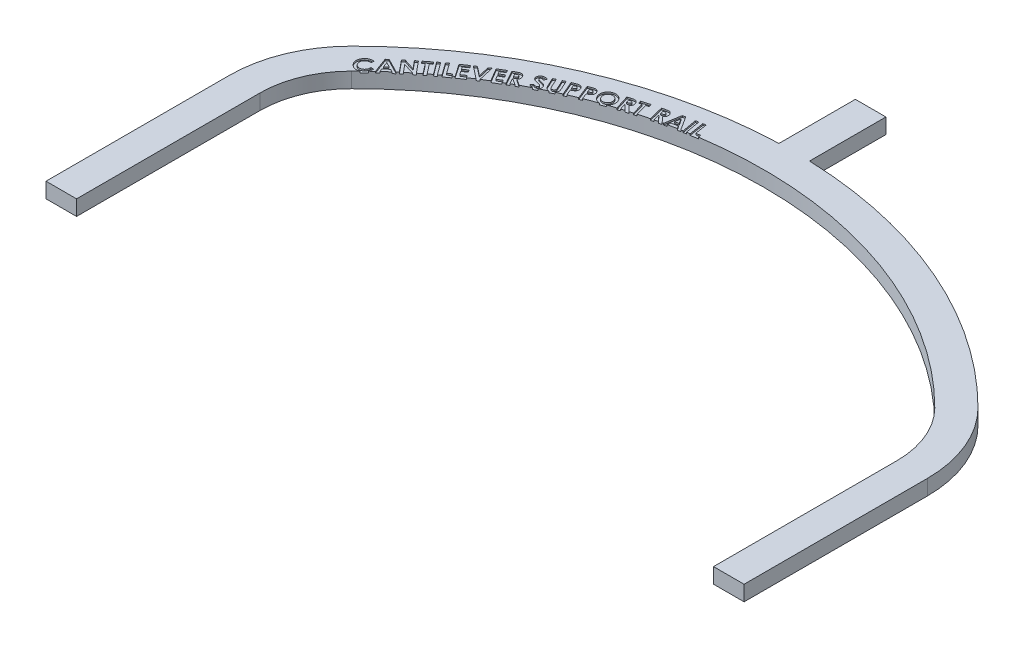
from build123d import *

# Parameters (mm, degrees)
BOSS_EXTRUDE1_DEPTH = 12.7
CUT_EXTRUDE1_DEPTH  = 1.27


with BuildPart() as part:
    # Sketch1 → Boss-Extrude1 (new body)
    with BuildSketch(Plane(origin=(0, 0, 0), x_dir=(1, 0, 0), z_dir=(0, 1, 0))):
        with BuildLine():
            Line((-12.7, 368.080969353), (-12.7, 431.580969353))
            Line((-12.7, 431.580969353), (12.7, 431.580969353))
            Line((12.7, 431.580969353), (12.7, 368.080969353))
            ThreePointArc((12.7, 368.080969353), (146.788859191, 337.783837413), (260.427427511, 260.427427511))
            ThreePointArc((260.427427511, 260.427427511), (282.451539046, 227.466015271), (290.185378542, 188.585378542))
            Line((290.185378542, 188.585378542), (290.185378542, 36.185378542))
            Line((290.185378542, 36.185378542), (264.785378542, 36.185378542))
            Line((264.785378542, 36.185378542), (264.785378542, 188.585378542))
            ThreePointArc((264.785378542, 188.585378542), (258.98499892, 217.745856089), (242.466915269, 242.466915269))
            ThreePointArc((242.466915269, 242.466915269), (0, 342.9), (-242.466915269, 242.466915269))
            ThreePointArc((-242.466915269, 242.466915269), (-258.98499892, 217.745856089), (-264.785378542, 188.585378542))
            Line((-264.785378542, 188.585378542), (-264.785378542, 36.185378542))
            Line((-264.785378542, 36.185378542), (-290.185378542, 36.185378542))
            Line((-290.185378542, 36.185378542), (-290.185378542, 188.585378542))
            ThreePointArc((-290.185378542, 188.585378542), (-282.451539046, 227.466015271), (-260.427427511, 260.427427511))
            ThreePointArc((-260.427427511, 260.427427511), (-146.788859191, 337.783837413), (-12.7, 368.080969353))
        make_face()
    extrude(amount=BOSS_EXTRUDE1_DEPTH)

    # Sketch2 → Cut-Extrude1 (cut)
    # profile 1 of 21: a face of its own
    with BuildSketch(Plane(origin=(0, 12.7, 0), x_dir=(1, 0, 0), z_dir=(0, 1, 0))):
        with BuildLine():
            Line((-240.273926487, 259.051710942), (-240.373145237, 256.721342352))
            add(Edge.make_bspline(
                [(-240.373145237, 256.721342352), (-240.576716843, 256.726749918), (-240.974276484, 256.737310475), (-241.557085733, 256.690475958), (-242.10963239, 256.593427501), (-242.63458079, 256.450482021), (-243.128175298, 256.249216858), (-243.593783069, 256.002014349), (-244.030973083, 255.704187979), (-244.291951553, 255.466949541), (-244.423305493, 255.347544275)],
                knots=[0, 0, 0, 0, 1.109410941, 2.166593966, 3.18036216, 4.16389883, 5.126121317, 6.079420305, 7.033346654, 8, 8, 8, 8], degree=3))
            add(Edge.make_bspline(
                [(-244.423305493, 255.347544275), (-244.528072502, 255.241800963), (-244.734045834, 255.033908207), (-245.001629247, 254.692988257), (-245.229723619, 254.337565094), (-245.418647135, 253.966808494), (-245.57098915, 253.581661237), (-245.677023148, 253.178264019), (-245.745411494, 252.760813784), (-245.77563675, 252.332500019), (-245.767119493, 251.903693619), (-245.712007309, 251.484812269), (-245.62189857, 251.078980889), (-245.484529469, 250.688795813), (-245.311419097, 250.309756904), (-245.096259922, 249.945273793), (-244.841692858, 249.593983185), (-244.643510262, 249.378949796), (-244.542876807, 249.26975982)],
                knots=[0, 0, 0, 0, 1.05288539, 2.069986666, 3.060674536, 4.03779584, 5.010871382, 5.986369008, 6.983996698, 8.000938564, 9.021611171, 10.014024932, 10.98669312, 11.958583158, 12.936202096, 13.931660634, 14.949735543, 16, 16, 16, 16], degree=3))
            add(Edge.make_bspline(
                [(-244.542876807, 249.26975982), (-244.469992066, 249.195895281), (-244.32575831, 249.049722575), (-244.096753417, 248.849630549), (-243.861693261, 248.66735926), (-243.619076708, 248.505421597), (-243.373378149, 248.356767394), (-243.120280478, 248.228379112), (-242.858984774, 248.12245874), (-242.506406183, 248.000207541), (-242.05483905, 247.896093391), (-241.504146585, 247.850308565), (-240.948984553, 247.880408267), (-240.489724297, 247.974389112), (-240.12527083, 248.080189741), (-239.858646368, 248.183593393), (-239.597394816, 248.300639345), (-239.34311415, 248.435459887), (-239.095701951, 248.588337235), (-238.857191155, 248.759684747), (-238.622858909, 248.945615153), (-238.476039778, 249.082982597), (-238.401490589, 249.152732577)],
                knots=[0, 0, 0, 0, 0.903983805, 1.7889201, 2.647675703, 3.494134373, 4.329292565, 5.14887473, 5.964014139, 6.784262305, 8.399364139, 9.986327642, 11.584947547, 13.226924465, 14.059299172, 14.889604802, 15.716450468, 16.552784756, 17.395623025, 18.248636513, 19.110724021, 20, 20, 20, 20], degree=3))
            add(Edge.make_bspline(
                [(-238.401490589, 249.152732577), (-238.280966974, 249.275006429), (-238.044501818, 249.514905517), (-237.740145463, 249.910276206), (-237.486535234, 250.325038079), (-237.314385973, 250.688928367), (-237.201384791, 250.9963086), (-237.12851714, 251.245539515), (-237.065142273, 251.513063767), (-237.011790888, 251.798349374), (-236.969856756, 252.101597557), (-236.932845079, 252.422029565), (-236.910845192, 252.761656736), (-236.904005733, 252.994252922), (-236.900488987, 253.113850365)],
                knots=[0, 0, 0, 0, 1.414772299, 2.775757688, 4.103421722, 5.417293633, 6.087640836, 6.802334444, 7.55712879, 8.353997277, 9.194617046, 10.081161745, 11.01336237, 12, 12, 12, 12], degree=3))
            Line((-236.900488987, 253.113850365), (-234.539591551, 253.019719756))
            add(Edge.make_bspline(
                [(-234.539591551, 253.019719756), (-234.546027697, 252.860223536), (-234.55860632, 252.548508609), (-234.597200809, 252.091938107), (-234.650422087, 251.658376646), (-234.716375542, 251.245721292), (-234.796551834, 250.85572744), (-234.893582706, 250.487185382), (-235.005353778, 250.141698169), (-235.130849493, 249.814230796), (-235.274881576, 249.500887552), (-235.438532332, 249.19591563), (-235.61901758, 248.894523127), (-235.821350239, 248.598838481), (-236.042465372, 248.307104163), (-236.281900061, 248.018599567), (-236.542188787, 247.736298061), (-236.72595829, 247.553535755), (-236.81907873, 247.460925686)],
                knots=[0, 0, 0, 0, 1.23744975, 2.418436995, 3.551148269, 4.623380775, 5.657504473, 6.636663909, 7.576447986, 8.471421849, 9.353993627, 10.248146037, 11.153563916, 12.076289761, 13.024362507, 13.990746612, 14.981862843, 16, 16, 16, 16], degree=3))
            add(Edge.make_bspline(
                [(-236.81907873, 247.460925686), (-236.99605553, 247.298181726), (-237.343544968, 246.978638107), (-237.903355723, 246.56429715), (-238.477739198, 246.211727127), (-239.070967127, 245.928756125), (-239.678857229, 245.707684968), (-240.304008258, 245.55380959), (-240.946266651, 245.468219427), (-241.599014669, 245.445246986), (-242.250458424, 245.487515359), (-242.887266336, 245.597598487), (-243.504473901, 245.771768745), (-244.102148727, 246.009481115), (-244.681130645, 246.311974059), (-245.23858094, 246.681117311), (-245.780004264, 247.11145073), (-246.111420852, 247.442272929), (-246.280476968, 247.611025846)],
                knots=[0, 0, 0, 0, 1.086136487, 2.132601335, 3.14236571, 4.128208339, 5.0982374, 6.061395575, 7.032310345, 8.021872026, 9.00915187, 9.977740874, 10.937605904, 11.902813736, 12.880086424, 13.884766916, 14.921016324, 16, 16, 16, 16], degree=3))
            add(Edge.make_bspline(
                [(-246.280476968, 247.611025846), (-246.385987027, 247.725288446), (-246.594570718, 247.951175107), (-246.88296962, 248.304732033), (-247.140626982, 248.66987764), (-247.369420277, 249.044135404), (-247.571939539, 249.425691813), (-247.741908956, 249.817792825), (-247.888997609, 250.216975325), (-248.001660563, 250.626764322), (-248.089801351, 251.041984175), (-248.144187697, 251.461409023), (-248.174048874, 251.883752386), (-248.168885765, 252.308638961), (-248.143790536, 252.737392303), (-248.07987537, 253.168669057), (-247.991582126, 253.602905495), (-247.874700291, 254.037201896), (-247.730315444, 254.46546796), (-247.560102066, 254.881667027), (-247.366323923, 255.284529582), (-247.144053164, 255.669945221), (-246.900249299, 256.043371426), (-246.628116409, 256.398847736), (-246.337967515, 256.745573823), (-246.122013168, 256.957935847), (-246.013349564, 257.064791871)],
                knots=[0, 0, 0, 0, 1.060695042, 2.096896624, 3.109582217, 4.106601159, 5.087242797, 6.053395843, 7.019548889, 7.986532736, 8.949685488, 9.912560284, 10.869107246, 11.835121756, 12.808984211, 13.796358489, 14.805999798, 15.830298554, 16.861969564, 17.886725538, 18.895687249, 19.908752735, 20.919487071, 21.935240766, 22.961057353, 24, 24, 24, 24], degree=3))
            add(Edge.make_bspline(
                [(-246.013349564, 257.064791871), (-245.918603101, 257.153376509), (-245.729593693, 257.330093713), (-245.427333451, 257.572515398), (-245.118309809, 257.803713924), (-244.792826322, 258.011598313), (-244.457930249, 258.20515363), (-244.110752327, 258.381336192), (-243.751491355, 258.539322994), (-243.380779141, 258.678081092), (-243.004326435, 258.800441138), (-242.622771309, 258.899940969), (-242.238877505, 258.978494278), (-241.851829404, 259.037986808), (-241.46094611, 259.072965658), (-241.067844788, 259.087813895), (-240.671081385, 259.084503401), (-240.406979877, 259.062696952), (-240.273926487, 259.051710942)],
                knots=[0, 0, 0, 0, 0.993554142, 1.982037902, 2.96718406, 3.949518728, 4.939283184, 5.930262769, 6.93116342, 7.944974585, 8.962195344, 9.963032712, 10.96471353, 11.963671667, 12.962037854, 13.970001103, 14.977293857, 16, 16, 16, 16], degree=3))
        make_face()
    # profile 2 of 21: a face of its own
    with BuildSketch(Plane(origin=(0, 12.7, 0), x_dir=(1, 0, 0), z_dir=(0, 1, 0))):
        Polygon((-237.04748947, 264.935164083), (-235.218302771, 266.55828107), (-223.164496681, 260.322764243), (-225.039476649, 258.658942128), (-227.512313188, 259.953874019), (-231.376756296, 256.521922897), (-230.415097643, 253.886265846), (-232.290077611, 252.22244373), align=None)
        Polygon((-233.890297963, 263.248445333), (-232.264636905, 258.877732192), (-229.748551168, 261.111426102), align=None, mode=Mode.SUBTRACT)
    # profile 3 of 21: a face of its own
    with BuildSketch(Plane(origin=(0, 12.7, 0), x_dir=(1, 0, 0), z_dir=(0, 1, 0))):
        Polygon((-229.753700372, 271.218781758), (-227.985571366, 272.676534162), (-218.559790116, 269.722868297), (-223.820927936, 276.108485284), (-221.973932744, 277.629839451), (-213.975375052, 267.924210444), (-215.748592199, 266.46391397), (-225.154020885, 269.404859483), (-219.905603417, 263.037050989), (-221.75514268, 261.513152752), align=None)
    # profile 4 of 21: a face of its own
    with BuildSketch(Plane(origin=(0, 12.7, 0), x_dir=(1, 0, 0), z_dir=(0, 1, 0))):
        Polygon((-220.3398183, 278.930040516), (-214.844625992, 283.178638273), (-213.402138011, 281.313834587), (-215.213516217, 279.912051734), (-208.972911249, 271.837171927), (-210.893684486, 270.353978818), (-217.134289454, 278.428858625), (-218.897330319, 277.06523683), align=None)
    # profile 5 of 21: a face of its own
    with BuildSketch(Plane(origin=(0, 12.7, 0), x_dir=(1, 0, 0), z_dir=(0, 1, 0))):
        Polygon((-213.577988538, 284.292750139), (-211.65467123, 285.725061838), (-204.073341102, 275.551323857), (-205.996658409, 274.119012159), align=None)
    # profile 6 of 21: a face of its own
    with BuildSketch(Plane(origin=(0, 12.7, 0), x_dir=(1, 0, 0), z_dir=(0, 1, 0))):
        Polygon((-209.321783282, 287.412693457), (-207.362848987, 288.819564451), (-201.310505237, 280.396146983), (-198.456058121, 282.446667816), (-197.115332961, 280.579320059), (-201.928714371, 277.121928233), align=None)
    # profile 7 of 21: a face of its own
    with BuildSketch(Plane(origin=(0, 12.7, 0), x_dir=(1, 0, 0), z_dir=(0, 1, 0))):
        Polygon((-202.660073181, 292.058496189), (-196.979163726, 295.93311558), (-195.656247059, 293.994533849), (-199.370590008, 291.460639619), (-198.085834399, 289.578027439), (-194.37149145, 292.11192167), (-193.074015489, 290.208956926), (-196.788358437, 287.675062696), (-194.921010681, 284.937642824), (-191.206667732, 287.471537054), (-189.878662925, 285.525323112), (-195.55957238, 281.650703721), align=None)
    # profile 8 of 21: a face of its own
    with BuildSketch(Plane(origin=(0, 12.7, 0), x_dir=(1, 0, 0), z_dir=(0, 1, 0))):
        Polygon((-195.591360854, 296.865199597), (-193.507767104, 298.193204405), (-186.015479444, 292.336754085), (-188.116881687, 301.627699597), (-186.033287937, 302.953160335), (-183.089798354, 289.869005687), (-185.043644508, 288.624955206), align=None)
    # profile 9 of 21: a face of its own
    with BuildSketch(Plane(origin=(0, 12.7, 0), x_dir=(1, 0, 0), z_dir=(0, 1, 0))):
        Polygon((-183.985775363, 304.225697806), (-178.047914786, 307.749235467), (-176.847113504, 305.724155338), (-180.729365107, 303.419227454), (-179.561636741, 301.452660947), (-175.679385139, 303.757588832), (-174.49639235, 301.768125691), (-178.378643953, 299.463197806), (-176.67920485, 296.60111848), (-172.796953248, 298.906046364), (-171.591063825, 296.873334024), (-177.528924402, 293.349796364), align=None)
    # profile 10 of 21: a face of its own
    with BuildSketch(Plane(origin=(0, 12.7, 0), x_dir=(1, 0, 0), z_dir=(0, 1, 0))):
        with BuildLine():
            Line((-175.631666635, 309.022997958), (-173.410693077, 310.254328087))
            add(Edge.make_bspline(
                [(-173.410693077, 310.254328087), (-173.263480566, 310.334671303), (-172.980111142, 310.489323995), (-172.565676345, 310.702409723), (-172.176101972, 310.880822613), (-171.817606084, 311.03944093), (-171.48349854, 311.164257712), (-171.176958167, 311.26117567), (-170.897764935, 311.332269752), (-170.563695603, 311.386775345), (-170.16250014, 311.399284731), (-169.691987248, 311.337221691), (-169.229462888, 311.199528624), (-168.858342417, 311.023381), (-168.570579011, 310.850432042), (-168.362684666, 310.700907549), (-168.164007441, 310.535748229), (-167.976114345, 310.352783588), (-167.799509483, 310.152065754), (-167.632274969, 309.936193282), (-167.472947614, 309.704128205), (-167.378421655, 309.539292569), (-167.330364551, 309.455489946)],
                knots=[0, 0, 0, 0, 1.424970873, 2.742927032, 3.958251133, 5.065194439, 6.072955567, 6.986777354, 7.795889123, 8.518467898, 9.859347431, 11.18920513, 12.534298296, 13.94288944, 14.667011306, 15.384832427, 16.116408083, 16.860333809, 17.610687034, 18.386083837, 19.179483203, 20, 20, 20, 20], degree=3))
            add(Edge.make_bspline(
                [(-167.330364551, 309.455489946), (-167.282252963, 309.366322276), (-167.188117842, 309.191856834), (-167.074062581, 308.9220083), (-166.98053146, 308.655878669), (-166.903964766, 308.392483605), (-166.856347581, 308.12983891), (-166.831127728, 307.868590731), (-166.825150627, 307.609926491), (-166.843186833, 307.35273618), (-166.884597352, 307.099415832), (-166.94486107, 306.846671271), (-167.034027364, 306.597944239), (-167.138391131, 306.347525417), (-167.274253118, 306.10338081), (-167.426018935, 305.85834353), (-167.601978886, 305.615925311), (-167.733803091, 305.461282372), (-167.801017596, 305.382433055)],
                knots=[0, 0, 0, 0, 1.100673466, 2.153577434, 3.179676407, 4.165924668, 5.131279157, 6.075907264, 7.016208807, 7.940151276, 8.873561413, 9.803506696, 10.759576589, 11.74228696, 12.748573433, 13.791994873, 14.874182699, 16, 16, 16, 16], degree=3))
            Line((-167.801017596, 305.382433055), (-162.491542436, 301.93776158))
            Line((-162.491542436, 301.93776158), (-164.776117757, 300.670814465))
            Line((-164.776117757, 300.670814465), (-169.831185866, 303.955209497))
            Line((-169.831185866, 303.955209497), (-170.024535225, 303.845814465))
            Line((-170.024535225, 303.845814465), (-167.444847725, 299.190165426))
            Line((-167.444847725, 299.190165426), (-169.538617757, 298.030069273))
            Line((-169.538617757, 298.030069273), (-175.631666635, 309.022997958))
        make_face()
        with BuildLine():
            Line((-171.156646603, 305.886159016), (-170.50027641, 306.2499611))
            add(Edge.make_bspline(
                [(-170.50027641, 306.2499611), (-170.420111174, 306.295002794), (-170.266498147, 306.381311913), (-170.052548176, 306.517456158), (-169.860048589, 306.647699702), (-169.696628726, 306.781492615), (-169.550756968, 306.905401792), (-169.43125834, 307.029595737), (-169.335162927, 307.151710242), (-169.243811082, 307.310967185), (-169.171936535, 307.520461462), (-169.164096105, 307.790763103), (-169.228872615, 308.075714182), (-169.319765711, 308.257244841), (-169.368165032, 308.353907414)],
                knots=[0, 0, 0, 0, 1.203009883, 2.305213542, 3.317980992, 4.241718513, 5.067472284, 5.820938469, 6.493487216, 7.094992157, 8.217949559, 9.350733708, 10.589302223, 12, 12, 12, 12], degree=3))
            add(Edge.make_bspline(
                [(-169.368165032, 308.353907414), (-169.402027667, 308.411096188), (-169.468099676, 308.522681635), (-169.595091214, 308.66670891), (-169.738628973, 308.785295868), (-169.898583624, 308.876530075), (-170.066564869, 308.946213278), (-170.244920263, 308.984195279), (-170.427390452, 308.997224593), (-170.585482406, 308.984123095), (-170.720062041, 308.956791619), (-170.837049399, 308.924085734), (-170.966358479, 308.873316656), (-171.112055962, 308.815566981), (-171.271609079, 308.744275148), (-171.445060932, 308.659374368), (-171.632908033, 308.563402515), (-171.761483905, 308.492503471), (-171.828281218, 308.455670234)],
                knots=[0, 0, 0, 0, 1.131481788, 2.207721762, 3.255897772, 4.292837267, 5.337614967, 6.344773761, 7.388650056, 8.448042132, 9.038037386, 9.729414435, 10.516576913, 11.405579109, 12.40271825, 13.495929189, 14.699093398, 16, 16, 16, 16], degree=3))
            Line((-171.828281218, 308.455670234), (-172.403241154, 308.13511735))
            Line((-172.403241154, 308.13511735), (-171.156646603, 305.886159016))
        make_face(mode=Mode.SUBTRACT)
    # profile 11 of 21: a face of its own
    with BuildSketch(Plane(origin=(0, 12.7, 0), x_dir=(1, 0, 0), z_dir=(0, 1, 0))):
        with BuildLine():
            Line((-155.315957349, 317.940405077), (-156.203837958, 315.729607801))
            add(Edge.make_bspline(
                [(-156.203837958, 315.729607801), (-156.319176088, 315.788203354), (-156.540405224, 315.90059501), (-156.872889752, 316.034400489), (-157.188257154, 316.128502114), (-157.486044849, 316.190377136), (-157.766632611, 316.211019952), (-158.030331552, 316.196886583), (-158.27836809, 316.145698339), (-158.429160468, 316.078352775), (-158.503677701, 316.045072545)],
                knots=[0, 0, 0, 0, 1.288432312, 2.471331603, 3.564577863, 4.563672574, 5.495453102, 6.35868141, 7.188907812, 8, 8, 8, 8], degree=3))
            add(Edge.make_bspline(
                [(-158.503677701, 316.045072545), (-158.57057279, 316.009315365), (-158.699220048, 315.940550029), (-158.861073853, 315.801295786), (-158.99523472, 315.648477681), (-159.08755168, 315.475067896), (-159.145500397, 315.299874006), (-159.171386729, 315.130031121), (-159.158120634, 314.967130337), (-159.11693731, 314.869801551), (-159.096446131, 314.821374628)],
                knots=[0, 0, 0, 0, 1.207344978, 2.321868833, 3.387898896, 4.435897551, 5.433364484, 6.321697082, 7.164943392, 8, 8, 8, 8], degree=3))
            add(Edge.make_bspline(
                [(-159.096446131, 314.821374628), (-159.071225355, 314.775055794), (-159.020629646, 314.682135011), (-158.909352933, 314.56692111), (-158.783502195, 314.46042556), (-158.684665439, 314.408282871), (-158.633425297, 314.381250429)],
                knots=[0, 0, 0, 0, 0.969066915, 1.944057046, 2.934133273, 4, 4, 4, 4], degree=3))
            add(Edge.make_bspline(
                [(-158.633425297, 314.381250429), (-158.590422241, 314.36196993), (-158.489870172, 314.316887223), (-158.312191668, 314.257686821), (-158.092484214, 314.180603972), (-157.825641453, 314.105050882), (-157.514031017, 314.0169014), (-157.156864137, 313.925581243), (-156.756101259, 313.818267768), (-156.472839172, 313.750469652), (-156.323409272, 313.714703955)],
                knots=[0, 0, 0, 0, 0.469718034, 1.098320083, 1.865848005, 2.79171113, 3.862766277, 5.09555632, 6.467812136, 8, 8, 8, 8], degree=3))
            add(Edge.make_bspline(
                [(-156.323409272, 313.714703955), (-156.184318443, 313.680844563), (-155.920526111, 313.616628624), (-155.545850841, 313.524420257), (-155.212979914, 313.443978523), (-154.922793842, 313.37072155), (-154.675717041, 313.303353774), (-154.469825897, 313.248918688), (-154.307175044, 313.200658757), (-154.213484037, 313.17040778), (-154.173669688, 313.157552513)],
                knots=[0, 0, 0, 0, 1.546761632, 2.933506564, 4.169135563, 5.246970881, 6.167143679, 6.936224424, 7.547944532, 8, 8, 8, 8], degree=3))
            add(Edge.make_bspline(
                [(-154.173669688, 313.157552513), (-154.016782985, 313.101229968), (-153.715924022, 312.993221182), (-153.296947761, 312.803219738), (-152.929710709, 312.593847281), (-152.608639587, 312.365857732), (-152.329052172, 312.11026736), (-152.077468713, 311.830059078), (-151.857620315, 311.51435119), (-151.735087062, 311.286411529), (-151.672848374, 311.170633442)],
                knots=[0, 0, 0, 0, 1.216333729, 2.332542496, 3.352852814, 4.29759538, 5.200260809, 6.112131746, 7.041089328, 8, 8, 8, 8], degree=3))
            add(Edge.make_bspline(
                [(-151.672848374, 311.170633442), (-151.619071436, 311.055332315), (-151.513356717, 310.82867333), (-151.392048285, 310.478205818), (-151.314504171, 310.126209693), (-151.269449129, 309.775334882), (-151.264335304, 309.424564313), (-151.29885114, 309.074423078), (-151.36641626, 308.723241479), (-151.477699992, 308.37755593), (-151.617203149, 308.038873837), (-151.798251489, 307.720193314), (-152.006765611, 307.418777638), (-152.24827892, 307.136064828), (-152.523721939, 306.874708805), (-152.831704952, 306.632243445), (-153.170235509, 306.406460403), (-153.415121943, 306.27790094), (-153.540196131, 306.212240013)],
                knots=[0, 0, 0, 0, 1.027009569, 2.018895665, 2.98750587, 3.932912021, 4.871222577, 5.81364762, 6.76990499, 7.75324346, 8.741505849, 9.722624078, 10.706677686, 11.697570359, 12.719613248, 13.767753892, 14.859894506, 16, 16, 16, 16], degree=3))
            add(Edge.make_bspline(
                [(-153.540196131, 306.212240013), (-153.640516515, 306.16425881), (-153.838468176, 306.069582551), (-154.14108224, 305.952867897), (-154.443002416, 305.860487344), (-154.745041828, 305.792080746), (-155.046450164, 305.742613333), (-155.347789384, 305.7192164), (-155.64793445, 305.723599869), (-155.948394511, 305.744709006), (-156.250365624, 305.794175492), (-156.553940392, 305.868343159), (-156.859933283, 305.968213444), (-157.168286912, 306.093589534), (-157.479258591, 306.24413181), (-157.791473451, 306.421086015), (-158.109311277, 306.61861938), (-158.314665482, 306.768854334), (-158.419723374, 306.84571357)],
                knots=[0, 0, 0, 0, 1.021933519, 2.016473901, 2.978180435, 3.921803429, 4.861198888, 5.783721026, 6.695809493, 7.618331631, 8.550030058, 9.504824365, 10.488428649, 11.506071816, 12.562477444, 13.661869595, 14.80382751, 16, 16, 16, 16], degree=3))
            Line((-158.419723374, 306.84571357), (-157.155320329, 308.847897064))
            add(Edge.make_bspline(
                [(-157.155320329, 308.847897064), (-157.02880397, 308.762273159), (-156.786901833, 308.598558319), (-156.414939997, 308.402897498), (-156.06221176, 308.25138864), (-155.721672047, 308.155578072), (-155.397364401, 308.107360031), (-155.08762386, 308.110575552), (-154.793181022, 308.16920252), (-154.61267824, 308.246776271), (-154.522207349, 308.285657481)],
                knots=[0, 0, 0, 0, 1.295791423, 2.477582482, 3.561755213, 4.548550678, 5.47186939, 6.335783654, 7.165868054, 8, 8, 8, 8], degree=3))
            add(Edge.make_bspline(
                [(-154.522207349, 308.285657481), (-154.434809093, 308.334672036), (-154.264898224, 308.42996119), (-154.044500781, 308.615086749), (-153.871617771, 308.833581934), (-153.742759748, 309.073300699), (-153.661385821, 309.321662394), (-153.629761149, 309.566691929), (-153.65727139, 309.803077924), (-153.716520014, 309.946276513), (-153.746265842, 310.0181695)],
                knots=[0, 0, 0, 0, 1.143564403, 2.223202512, 3.264576636, 4.309597527, 5.317976465, 6.235233605, 7.113997363, 8, 8, 8, 8], degree=3))
            add(Edge.make_bspline(
                [(-153.746265842, 310.0181695), (-153.78219391, 310.080800452), (-153.855267876, 310.208185315), (-154.010468605, 310.374280224), (-154.198562508, 310.522737186), (-154.38359159, 310.630062641), (-154.558436898, 310.710488912), (-154.720498915, 310.772253851), (-154.910274322, 310.839179219), (-155.127503927, 310.907045099), (-155.373034272, 310.975223959), (-155.64604893, 311.046802974), (-155.947342255, 311.119721467), (-156.157997173, 311.168294631), (-156.26743972, 311.193530077)],
                knots=[0, 0, 0, 0, 0.904392643, 1.839440868, 2.832566859, 3.906754087, 4.516791442, 5.248665761, 6.084129627, 7.044262176, 8.106500343, 9.284610759, 10.589260969, 12, 12, 12, 12], degree=3))
            add(Edge.make_bspline(
                [(-156.26743972, 311.193530077), (-156.476215077, 311.242041566), (-156.877519652, 311.335289556), (-157.451790863, 311.480063442), (-157.97474713, 311.62179264), (-158.445869268, 311.763549678), (-158.864915594, 311.905565276), (-159.233348282, 312.044264572), (-159.549095896, 312.183941994), (-159.820529142, 312.32223172), (-160.054319732, 312.469981245), (-160.268321904, 312.619112779), (-160.465843293, 312.776853745), (-160.64271533, 312.945244034), (-160.806377293, 313.119410669), (-160.949242629, 313.30452375), (-161.079296545, 313.496626142), (-161.15150852, 313.631763225), (-161.187672092, 313.699439532)],
                knots=[0, 0, 0, 0, 1.803352331, 3.466374349, 4.982656095, 6.361792992, 7.605036407, 8.704878885, 9.672752931, 10.508866034, 11.265183268, 11.997597242, 12.702959278, 13.389410693, 14.050820359, 14.711652492, 15.354798853, 16, 16, 16, 16], degree=3))
            add(Edge.make_bspline(
                [(-161.187672092, 313.699439532), (-161.232811318, 313.797020898), (-161.322221191, 313.990305947), (-161.422185469, 314.291812745), (-161.485432361, 314.598407538), (-161.516388085, 314.907960277), (-161.513643945, 315.220114917), (-161.477331758, 315.535488343), (-161.407571891, 315.854786698), (-161.307020051, 316.174380908), (-161.175645917, 316.48658383), (-161.014316259, 316.780914647), (-160.831608112, 317.05981052), (-160.615798034, 317.312622899), (-160.378428629, 317.549740929), (-160.112141245, 317.762850757), (-159.820901711, 317.957759866), (-159.612215452, 318.06934878), (-159.506041483, 318.126122224)],
                knots=[0, 0, 0, 0, 0.978807472, 1.938780495, 2.885611155, 3.824849332, 4.767258478, 5.723494971, 6.711313275, 7.739820134, 8.771339242, 9.790990045, 10.793616708, 11.802413438, 12.812894428, 13.845540864, 14.903869007, 16, 16, 16, 16], degree=3))
            add(Edge.make_bspline(
                [(-159.506041483, 318.126122224), (-159.36327687, 318.191573564), (-159.079637036, 318.321610041), (-158.629579744, 318.453609365), (-158.166507533, 318.52972939), (-157.769385322, 318.548495824), (-157.440315255, 318.536444661), (-157.177919955, 318.504263833), (-156.902019301, 318.455487658), (-156.611783044, 318.388737942), (-156.307086758, 318.304674938), (-155.987798781, 318.202470908), (-155.655406787, 318.080300681), (-155.430984642, 317.987810702), (-155.315957349, 317.940405077)],
                knots=[0, 0, 0, 0, 1.300191544, 2.583175937, 3.872534588, 5.181207131, 5.870490449, 6.599234554, 7.369876731, 8.19160127, 9.066226339, 9.988563798, 10.969040855, 12, 12, 12, 12], degree=3))
        make_face()
    # profile 12 of 21: a face of its own
    with BuildSketch(Plane(origin=(0, 12.7, 0), x_dir=(1, 0, 0), z_dir=(0, 1, 0))):
        with BuildLine():
            Line((-153.58454512, 320.630358434), (-151.396644479, 321.645442569))
            Line((-151.396644479, 321.645442569), (-147.951973005, 314.226932953))
            add(Edge.make_bspline(
                [(-147.951973005, 314.226932953), (-147.916002385, 314.150365852), (-147.84680708, 314.003076647), (-147.738853731, 313.794105312), (-147.636826041, 313.603535466), (-147.532796546, 313.435710378), (-147.438472856, 313.283505968), (-147.340037835, 313.155176787), (-147.25104395, 313.041569813), (-147.130671019, 312.922953459), (-146.975159488, 312.799614656), (-146.767439876, 312.689751233), (-146.544021228, 312.609871752), (-146.303870404, 312.563751365), (-146.051467773, 312.556819283), (-145.791339285, 312.588901777), (-145.524870558, 312.65740282), (-145.351927318, 312.731191645), (-145.262890473, 312.76918055)],
                knots=[0, 0, 0, 0, 1.149479394, 2.211209569, 3.196243768, 4.085626759, 4.894377315, 5.627321221, 6.282480884, 6.852900586, 7.920244789, 8.966920453, 10.031274193, 11.134232795, 12.27565411, 13.44778665, 14.686036954, 16, 16, 16, 16], degree=3))
            add(Edge.make_bspline(
                [(-145.262890473, 312.76918055), (-145.171443196, 312.814902746), (-144.993519695, 312.903861689), (-144.758259294, 313.078068229), (-144.554007954, 313.270546762), (-144.391413872, 313.489214886), (-144.265154116, 313.718016184), (-144.175395465, 313.953325147), (-144.129298053, 314.192522077), (-144.12431512, 314.398032259), (-144.14519917, 314.573047219), (-144.176913038, 314.725839535), (-144.222598868, 314.899428004), (-144.288176716, 315.09293737), (-144.366480047, 315.308624058), (-144.461337876, 315.545032378), (-144.570223472, 315.80267188), (-144.652570241, 315.979213357), (-144.695562748, 316.071384075)],
                knots=[0, 0, 0, 0, 1.263512669, 2.458341062, 3.60919016, 4.726214783, 5.816273454, 6.83612587, 7.830590142, 8.817656804, 9.367192151, 10.00956662, 10.748040598, 11.587972864, 12.537825476, 13.588603218, 14.741031412, 16, 16, 16, 16], degree=3))
            Line((-144.695562748, 316.071384075), (-148.013030697, 323.215134075))
            Line((-148.013030697, 323.215134075), (-145.825130056, 324.23276228))
            Line((-145.825130056, 324.23276228), (-142.650130056, 317.399388883))
            add(Edge.make_bspline(
                [(-142.650130056, 317.399388883), (-142.586006448, 317.260551624), (-142.462959647, 316.994136787), (-142.294446589, 316.607560536), (-142.150150993, 316.249509171), (-142.021122384, 315.924541081), (-141.920021505, 315.626416713), (-141.835065161, 315.361695435), (-141.771763692, 315.125991478), (-141.721498382, 314.850422649), (-141.689775504, 314.5176675), (-141.704907389, 314.113040153), (-141.764039492, 313.69351884), (-141.870069852, 313.26738419), (-142.018590569, 312.848776641), (-142.205555403, 312.451982429), (-142.437890818, 312.087620904), (-142.708348893, 311.751240326), (-143.026580888, 311.446228767), (-143.387815167, 311.166127196), (-143.794394733, 310.906689902), (-144.090232189, 310.760789487), (-144.242718197, 310.6855868)],
                knots=[0, 0, 0, 0, 1.155815555, 2.217894638, 3.186708152, 4.073433045, 4.859865436, 5.565289667, 6.174673327, 6.702648519, 7.680976669, 8.69414365, 9.755545664, 10.87787675, 12.007013279, 13.107855196, 14.185370386, 15.265417797, 16.362315874, 17.508495301, 18.715782609, 20, 20, 20, 20], degree=3))
            add(Edge.make_bspline(
                [(-144.242718197, 310.6855868), (-144.345694787, 310.640330418), (-144.549374577, 310.550816769), (-144.858251434, 310.438814448), (-145.166439497, 310.352362135), (-145.472004616, 310.285103671), (-145.776496711, 310.241871382), (-146.079179065, 310.22217446), (-146.37943664, 310.220312521), (-146.676164194, 310.24694227), (-146.965548815, 310.293317003), (-147.245171953, 310.353870413), (-147.513403671, 310.429643403), (-147.768721603, 310.523817951), (-148.01053815, 310.63642316), (-148.241519281, 310.763970244), (-148.459523397, 310.909374992), (-148.671555602, 311.072018758), (-148.876601494, 311.268387444), (-149.081219321, 311.504034238), (-149.293742685, 311.780346162), (-149.507418445, 312.10158037), (-149.729948075, 312.462904715), (-149.951826172, 312.86981685), (-150.184817021, 313.316196309), (-150.332759602, 313.632708243), (-150.40954512, 313.796985037)],
                knots=[0, 0, 0, 0, 1.019533991, 2.016559975, 2.975391818, 3.919314768, 4.851043733, 5.760268575, 6.667411021, 7.570145161, 8.457394314, 9.322929239, 10.162433056, 10.98213245, 11.786989162, 12.578480951, 13.371651014, 14.160525058, 14.99794954, 15.940274558, 16.987404441, 18.155851046, 19.436092564, 20.833152037, 22.356334865, 24, 24, 24, 24], degree=3))
            Line((-150.40954512, 313.796985037), (-153.58454512, 320.630358434))
        make_face()
    # profile 13 of 21: a face of its own
    with BuildSketch(Plane(origin=(0, 12.7, 0), x_dir=(1, 0, 0), z_dir=(0, 1, 0))):
        with BuildLine():
            Line((-142.930282872, 325.468458155), (-140.59228207, 326.465733796))
            add(Edge.make_bspline(
                [(-140.59228207, 326.465733796), (-140.439218681, 326.530399238), (-140.144975335, 326.654709668), (-139.712414563, 326.817489676), (-139.309808211, 326.957701493), (-138.935062447, 327.073710991), (-138.588414333, 327.162312684), (-138.271547996, 327.231228189), (-137.981331715, 327.26918467), (-137.715958869, 327.286598818), (-137.466691607, 327.277561434), (-137.226844802, 327.25258055), (-136.992130668, 327.208986465), (-136.76196373, 327.148403637), (-136.53839201, 327.066650936), (-136.320453328, 326.965855976), (-136.107168448, 326.849779512), (-135.900594036, 326.714294873), (-135.702802183, 326.561686547), (-135.513167239, 326.393357804), (-135.335700692, 326.206912629), (-135.167478771, 326.006126445), (-135.01094947, 325.788948339), (-134.870313926, 325.553003339), (-134.733473355, 325.305096159), (-134.655690441, 325.12987704), (-134.616260436, 325.041054309)],
                knots=[0, 0, 0, 0, 1.690927082, 3.250575085, 4.702612146, 6.029417044, 7.241417873, 8.343326477, 9.327133416, 10.217586994, 11.046524209, 11.862373669, 12.66982604, 13.473718994, 14.281862935, 15.088992372, 15.915544928, 16.750971425, 17.600280649, 18.456055235, 19.328936234, 20.217379945, 21.12033508, 22.049873714, 23.011434687, 24, 24, 24, 24], degree=3))
            add(Edge.make_bspline(
                [(-134.616260436, 325.041054309), (-134.575680441, 324.941562848), (-134.495877683, 324.745907501), (-134.405151015, 324.447797239), (-134.338045136, 324.154543955), (-134.296840034, 323.865230634), (-134.281063727, 323.579997715), (-134.292235019, 323.299221017), (-134.323575285, 323.022824984), (-134.385825446, 322.753209), (-134.471178196, 322.49140263), (-134.5711938, 322.235454554), (-134.697937303, 321.990665916), (-134.842653835, 321.753845811), (-135.008350589, 321.52567007), (-135.19875216, 321.31096773), (-135.403768263, 321.099323014), (-135.556349351, 320.971763466), (-135.633888641, 320.906939726)],
                knots=[0, 0, 0, 0, 1.119072067, 2.200715822, 3.24250273, 4.250930367, 5.241981801, 6.21458458, 7.175761438, 8.136085018, 9.091763224, 10.043429913, 10.995793689, 11.959606858, 12.933413006, 13.929219219, 14.947662044, 16, 16, 16, 16], degree=3))
            add(Edge.make_bspline(
                [(-135.633888641, 320.906939726), (-135.686025236, 320.867311358), (-135.7995988, 320.780985526), (-135.993269374, 320.655734224), (-136.220529815, 320.520543009), (-136.483553791, 320.377832336), (-136.783668153, 320.229880766), (-137.116366272, 320.06917551), (-137.48409768, 319.900349324), (-137.742661588, 319.789497959), (-137.877758833, 319.731579149)],
                knots=[0, 0, 0, 0, 0.618834324, 1.34805925, 2.178390007, 3.118164464, 4.175683705, 5.340885146, 6.61063714, 8, 8, 8, 8], degree=3))
            Line((-137.877758833, 319.731579149), (-135.786532872, 314.829155271))
            Line((-135.786532872, 314.829155271), (-137.989697936, 313.890393252))
            Line((-137.989697936, 313.890393252), (-142.930282872, 325.468458155))
        make_face()
        with BuildLine():
            Line((-138.796168288, 321.881318732), (-138.096548897, 322.178974982))
            add(Edge.make_bspline(
                [(-138.096548897, 322.178974982), (-137.969719819, 322.234708473), (-137.736650206, 322.33712807), (-137.424395485, 322.492252242), (-137.184068823, 322.639354012), (-137.001024275, 322.774954214), (-136.871623251, 322.917442598), (-136.768911344, 323.063181742), (-136.698843899, 323.223945348), (-136.648697718, 323.392840326), (-136.628304588, 323.571939453), (-136.640042819, 323.756277853), (-136.677636461, 323.94545494), (-136.725828998, 324.067303811), (-136.750735596, 324.130277066)],
                knots=[0, 0, 0, 0, 1.831775211, 3.36619288, 4.604640965, 5.555580537, 6.364893977, 7.13927924, 7.90205093, 8.672122036, 9.462097817, 10.270634191, 11.106238803, 12, 12, 12, 12], degree=3))
            add(Edge.make_bspline(
                [(-136.750735596, 324.130277066), (-136.774865643, 324.183547489), (-136.82183486, 324.287238542), (-136.912241379, 324.427252569), (-137.011569722, 324.551455549), (-137.123564066, 324.656461435), (-137.248750349, 324.741411166), (-137.383087944, 324.810828161), (-137.530860695, 324.859971165), (-137.634066319, 324.877092343), (-137.686953545, 324.885866008)],
                knots=[0, 0, 0, 0, 1.108631893, 2.157955621, 3.153431515, 4.121462553, 5.059039581, 6.016440726, 6.983534593, 8, 8, 8, 8], degree=3))
            add(Edge.make_bspline(
                [(-137.686953545, 324.885866008), (-137.729322455, 324.889170596), (-137.819934886, 324.896237966), (-137.965083063, 324.890869005), (-138.126364302, 324.865805263), (-138.305178398, 324.828189102), (-138.500190663, 324.769802513), (-138.714996402, 324.702384895), (-138.945346041, 324.615142379), (-139.103361548, 324.548852647), (-139.185411077, 324.514431713)],
                knots=[0, 0, 0, 0, 0.653984151, 1.398645693, 2.229537362, 3.164219252, 4.209775769, 5.361759117, 6.630093807, 8, 8, 8, 8], degree=3))
            Line((-139.185411077, 324.514431713), (-139.806164282, 324.24984838))
            Line((-139.806164282, 324.24984838), (-138.796168288, 321.881318732))
        make_face(mode=Mode.SUBTRACT)
    # profile 14 of 21: a face of its own
    with BuildSketch(Plane(origin=(0, 12.7, 0), x_dir=(1, 0, 0), z_dir=(0, 1, 0))):
        with BuildLine():
            Line((-133.449379469, 329.450158874), (-131.088482033, 330.378744611))
            add(Edge.make_bspline(
                [(-131.088482033, 330.378744611), (-130.933581611, 330.438040363), (-130.635150401, 330.552279579), (-130.199841999, 330.70457549), (-129.794401087, 330.836665388), (-129.417332052, 330.940476974), (-129.068506742, 331.020520213), (-128.749432078, 331.077940388), (-128.458656011, 331.108706602), (-128.193105535, 331.118679517), (-127.945855776, 331.100831428), (-127.706464287, 331.071991086), (-127.473534404, 331.020408836), (-127.246232565, 330.951986074), (-127.026254979, 330.864346144), (-126.811059253, 330.760365089), (-126.603573107, 330.634184487), (-126.399113787, 330.495047424), (-126.204116312, 330.337876546), (-126.020432973, 330.164321632), (-125.848597694, 329.974619977), (-125.689945063, 329.768282738), (-125.537780575, 329.549073675), (-125.400620768, 329.311431009), (-125.2768143, 329.057269991), (-125.203175037, 328.880670407), (-125.16588588, 328.791244611)],
                knots=[0, 0, 0, 0, 1.690971706, 3.257826704, 4.701545407, 6.03769772, 7.243728968, 8.349619834, 9.340721722, 10.22300603, 11.054651896, 11.865406004, 12.67942679, 13.483561252, 14.283127526, 15.091295784, 15.917214025, 16.756599211, 17.611340278, 18.467610516, 19.330706852, 20.217933968, 21.119661199, 22.049469544, 23.012298128, 24, 24, 24, 24], degree=3))
            add(Edge.make_bspline(
                [(-125.16588588, 328.791244611), (-125.127520651, 328.690952055), (-125.052084477, 328.493750396), (-124.973517834, 328.1929714), (-124.91242765, 327.89861114), (-124.879760057, 327.609118015), (-124.871310489, 327.323910647), (-124.890055101, 327.044851507), (-124.929328691, 326.769190167), (-124.99970956, 326.501930975), (-125.087979506, 326.239991324), (-125.20150676, 325.98950221), (-125.329247365, 325.745435587), (-125.486289063, 325.516913312), (-125.65378272, 325.290988609), (-125.849702918, 325.081526739), (-126.061408074, 324.877445746), (-126.21639016, 324.753455634), (-126.295453187, 324.690202944)],
                knots=[0, 0, 0, 0, 1.119200622, 2.20064409, 3.237997615, 4.252896345, 5.235082516, 6.210032964, 7.167002221, 8.134541552, 9.088398972, 10.046675453, 11.000409829, 11.957174671, 12.935489789, 13.930929299, 14.944478044, 16, 16, 16, 16], degree=3))
            add(Edge.make_bspline(
                [(-126.295453187, 324.690202944), (-126.348414803, 324.652193356), (-126.463550605, 324.569562484), (-126.660912615, 324.451587169), (-126.89269469, 324.324573308), (-127.160212377, 324.190129999), (-127.462755082, 324.048876733), (-127.799240258, 323.89703234), (-128.173408933, 323.744461915), (-128.43415684, 323.638615584), (-128.569852226, 323.583532271)],
                knots=[0, 0, 0, 0, 0.616935112, 1.341184906, 2.174787505, 3.119073227, 4.174954117, 5.335746697, 6.613500353, 8, 8, 8, 8], degree=3))
            Line((-128.569852226, 323.583532271), (-126.618550142, 318.630226983))
            Line((-126.618550142, 318.630226983), (-128.844611841, 317.755066726))
            Line((-128.844611841, 317.755066726), (-133.449379469, 329.450158874))
        make_face()
        with BuildLine():
            Line((-129.424659918, 325.753624419), (-128.717408316, 326.033472175))
            add(Edge.make_bspline(
                [(-128.717408316, 326.033472175), (-128.589795176, 326.085914585), (-128.35551498, 326.182191648), (-128.040127556, 326.32775409), (-127.795137298, 326.465499302), (-127.610351971, 326.596810162), (-127.475210202, 326.733678364), (-127.375020592, 326.880014757), (-127.291586585, 327.034563474), (-127.243000714, 327.203640346), (-127.216440086, 327.380837855), (-127.219227217, 327.564726409), (-127.252998402, 327.75454813), (-127.297577217, 327.877640284), (-127.320713604, 327.94152506)],
                knots=[0, 0, 0, 0, 1.829445723, 3.358611067, 4.602722299, 5.551823925, 6.354940194, 7.137967404, 7.89738525, 8.672867184, 9.456862689, 10.266564559, 11.100347739, 12, 12, 12, 12], degree=3))
            add(Edge.make_bspline(
                [(-127.320713604, 327.94152506), (-127.343246718, 327.995510335), (-127.387024534, 328.100394085), (-127.470801619, 328.243980823), (-127.569768116, 328.366727524), (-127.676388527, 328.476801393), (-127.799349892, 328.563796979), (-127.93097322, 328.638711853), (-128.077411393, 328.687909955), (-128.179527984, 328.709184772), (-128.231490848, 328.720010637)],
                knots=[0, 0, 0, 0, 1.113901604, 2.164111918, 3.153263189, 4.112944882, 5.072762576, 6.012793755, 6.988793837, 8, 8, 8, 8], degree=3))
            add(Edge.make_bspline(
                [(-128.231490848, 328.720010637), (-128.273829518, 328.725290036), (-128.364202128, 328.736559003), (-128.509342621, 328.731887173), (-128.671632895, 328.713239413), (-128.85097492, 328.68001727), (-129.04847758, 328.630233398), (-129.263362859, 328.567082491), (-129.495688011, 328.487503496), (-129.654676539, 328.426289468), (-129.737580591, 328.394369611)],
                knots=[0, 0, 0, 0, 0.657259141, 1.402930778, 2.232038404, 3.176153203, 4.213517427, 5.372403576, 6.629848365, 8, 8, 8, 8], degree=3))
            Line((-129.737580591, 328.394369611), (-130.365966008, 328.147594771))
            Line((-130.365966008, 328.147594771), (-129.424659918, 325.753624419))
        make_face(mode=Mode.SUBTRACT)
    # profile 15 of 21: a face of its own
    with BuildSketch(Plane(origin=(0, 12.7, 0), x_dir=(1, 0, 0), z_dir=(0, 1, 0))):
        with BuildLine():
            add(Edge.make_bspline(
                [(-118.390628487, 335.505239231), (-118.181517208, 335.57317924), (-117.769169647, 335.707150478), (-117.135838293, 335.830992474), (-116.505199787, 335.888608564), (-115.875855139, 335.889028111), (-115.24953151, 335.814803317), (-114.625280434, 335.680274264), (-114.00449299, 335.475765592), (-113.391655154, 335.214221321), (-112.804295325, 334.896220391), (-112.254795347, 334.532350719), (-111.757916231, 334.116701321), (-111.303696692, 333.661254816), (-110.904098585, 333.155328258), (-110.547103814, 332.608800608), (-110.243550477, 332.013204014), (-110.082182942, 331.592352167), (-110.000283935, 331.37875686)],
                knots=[0, 0, 0, 0, 1.014318021, 2.000138711, 2.97129861, 3.934368374, 4.89975879, 5.87726577, 6.877593681, 7.912375726, 8.949377065, 9.95699434, 10.949469907, 11.934979613, 12.921173356, 13.920175095, 14.944424638, 16, 16, 16, 16], degree=3))
            add(Edge.make_bspline(
                [(-110.000283935, 331.37875686), (-109.929793889, 331.163726009), (-109.790768472, 330.739627074), (-109.660056902, 330.091060508), (-109.59402747, 329.448728124), (-109.586020616, 328.811017628), (-109.651987798, 328.178626672), (-109.779066129, 327.550975647), (-109.975119141, 326.930559106), (-110.230296297, 326.321540792), (-110.539859915, 325.740066989), (-110.895331675, 325.198119085), (-111.295781424, 324.704310635), (-111.743317993, 324.261019676), (-112.232039785, 323.862664168), (-112.766988484, 323.51709771), (-113.343842711, 323.215590136), (-113.753558342, 323.059806897), (-113.961401724, 322.980780097)],
                knots=[0, 0, 0, 0, 1.049777138, 2.07044415, 3.063848648, 4.044124221, 5.0253795, 6.009756992, 7.01207628, 8.040774388, 9.071038111, 10.065728832, 11.045158225, 12.016667691, 12.985021458, 13.966655716, 14.968511039, 16, 16, 16, 16], degree=3))
            add(Edge.make_bspline(
                [(-113.961401724, 322.980780097), (-114.182409004, 322.909529252), (-114.616925527, 322.769444864), (-115.279397687, 322.635337979), (-115.933877609, 322.567242929), (-116.581096822, 322.57046381), (-117.220819737, 322.638662523), (-117.852026641, 322.776967438), (-118.474758598, 322.985681856), (-119.081023406, 323.25896733), (-119.661170681, 323.584816281), (-120.198438827, 323.957324502), (-120.691774796, 324.36686151), (-121.130048554, 324.824970146), (-121.528273768, 325.318278675), (-121.870154375, 325.858690661), (-122.170143486, 326.436786645), (-122.326024928, 326.846042508), (-122.405171756, 327.053836988)],
                knots=[0, 0, 0, 0, 1.06654582, 2.096907316, 3.099790742, 4.08585681, 5.065888812, 6.051299956, 7.04961386, 8.078905961, 9.103294125, 10.10333354, 11.079918542, 12.044633367, 13.0124373, 13.988718943, 14.97879752, 16, 16, 16, 16], degree=3))
            add(Edge.make_bspline(
                [(-122.405171756, 327.053836988), (-122.453094776, 327.195674519), (-122.548309534, 327.47748118), (-122.652407745, 327.907704274), (-122.733754958, 328.337087649), (-122.78090593, 328.767477626), (-122.801770798, 329.198273843), (-122.793687706, 329.629964436), (-122.758956985, 330.06188308), (-122.692341526, 330.491869117), (-122.597249867, 330.915208981), (-122.481994223, 331.330923642), (-122.336004827, 331.734624615), (-122.162130776, 332.12535216), (-121.966921329, 332.506714797), (-121.741837695, 332.873065986), (-121.491349237, 333.227725205), (-121.218007018, 333.569435628), (-120.92386914, 333.894692047), (-120.611182052, 334.19733828), (-120.281455342, 334.476228475), (-119.934895521, 334.730230804), (-119.573723718, 334.96285044), (-119.194844998, 335.16895018), (-118.80133061, 335.353837914), (-118.527958757, 335.454613771), (-118.390628487, 335.505239231)],
                knots=[0, 0, 0, 0, 1.035534977, 2.057429034, 3.059931195, 4.057906121, 5.050743721, 6.042627045, 7.043599468, 8.046994329, 9.050749479, 10.044627063, 11.030293805, 12.018176531, 13.002392336, 13.992712134, 14.990738816, 16.005260096, 17.018949433, 18.023253345, 19.014303096, 20.004901034, 20.994612126, 21.984671095, 22.987585371, 24, 24, 24, 24], degree=3))
        make_face()
        with BuildLine():
            add(Edge.make_bspline(
                [(-117.632495474, 333.274089392), (-117.766809475, 333.223365364), (-118.030736982, 333.123692462), (-118.401372067, 332.92978221), (-118.744365873, 332.709182135), (-119.056583784, 332.454076136), (-119.342257965, 332.172874085), (-119.596742525, 331.858448582), (-119.819652391, 331.513778731), (-120.015377797, 331.144083509), (-120.174470773, 330.75570808), (-120.293132984, 330.356092022), (-120.36659406, 329.949083282), (-120.399627517, 329.534951885), (-120.392230599, 329.113037115), (-120.34030422, 328.684560401), (-120.245937811, 328.249407489), (-120.152809071, 327.963045545), (-120.105332012, 327.817058142)],
                knots=[0, 0, 0, 0, 1.028141995, 2.020302798, 2.991296324, 3.946179023, 4.904536842, 5.859419541, 6.838821734, 7.841997113, 8.853240566, 9.841708797, 10.823991895, 11.811731174, 12.81470402, 13.842953789, 14.900337207, 16, 16, 16, 16], degree=3))
            add(Edge.make_bspline(
                [(-120.105332012, 327.817058142), (-120.045239443, 327.657776696), (-119.927510693, 327.345724708), (-119.694808473, 326.912775759), (-119.433896058, 326.517284741), (-119.133317088, 326.166006927), (-118.797953168, 325.855688516), (-118.427112958, 325.588047835), (-118.021328969, 325.359703946), (-117.729908583, 325.246592236), (-117.581614064, 325.189033302)],
                knots=[0, 0, 0, 0, 1.081191615, 2.118187657, 3.116994502, 4.088258106, 5.049656636, 6.014796499, 6.989793392, 8, 8, 8, 8], degree=3))
            add(Edge.make_bspline(
                [(-117.581614064, 325.189033302), (-117.46433113, 325.149687968), (-117.231524711, 325.071587548), (-116.87546798, 324.991295925), (-116.518854275, 324.941295773), (-116.162064244, 324.928078818), (-115.804495233, 324.938915318), (-115.446929183, 324.985827691), (-115.089350046, 325.064314697), (-114.855502765, 325.140408141), (-114.73734323, 325.17885702)],
                knots=[0, 0, 0, 0, 1.022320192, 2.029303804, 3.013021686, 3.995589343, 4.977881746, 5.967628803, 6.973073225, 8, 8, 8, 8], degree=3))
            add(Edge.make_bspline(
                [(-114.73734323, 325.17885702), (-114.60640142, 325.228730721), (-114.347381468, 325.327387396), (-113.984811187, 325.520356905), (-113.647096216, 325.739206272), (-113.34134079, 325.994093449), (-113.05853662, 326.275977368), (-112.810816909, 326.595046762), (-112.583515113, 326.939116069), (-112.393885877, 327.314334971), (-112.233775544, 327.705152873), (-112.112672304, 328.105350576), (-112.037655268, 328.510649495), (-111.996203373, 328.919439551), (-112.007386076, 329.333712272), (-112.051632562, 329.752158967), (-112.1414459, 330.174755531), (-112.231447327, 330.451746236), (-112.277227044, 330.592639071)],
                knots=[0, 0, 0, 0, 1.014463734, 2.006741359, 2.969720817, 3.925694691, 4.886003892, 5.857241711, 6.847519369, 7.869899524, 8.89806223, 9.905147405, 10.893421049, 11.88094931, 12.87662714, 13.890476493, 14.92697935, 16, 16, 16, 16], degree=3))
            add(Edge.make_bspline(
                [(-112.277227044, 330.592639071), (-112.329616868, 330.731205746), (-112.432612298, 331.003619989), (-112.631842477, 331.386272552), (-112.855556843, 331.742543855), (-113.1105414, 332.069775538), (-113.397920028, 332.36633306), (-113.714155315, 332.635057736), (-114.062537954, 332.871364767), (-114.43364551, 333.078279172), (-114.820340864, 333.251779913), (-115.215588633, 333.380697256), (-115.612992116, 333.472466413), (-116.01321879, 333.51702113), (-116.416460231, 333.523149664), (-116.821469395, 333.484179535), (-117.229730531, 333.402480196), (-117.496673498, 333.317385843), (-117.632495474, 333.274089392)],
                knots=[0, 0, 0, 0, 1.065421681, 2.09455875, 3.098703786, 4.090135368, 5.074325721, 6.066076656, 7.071704647, 8.099102634, 9.121046917, 10.117014937, 11.086906366, 12.051463124, 13.009820121, 13.984615827, 14.974562005, 16, 16, 16, 16], degree=3))
        make_face(mode=Mode.SUBTRACT)
    # profile 16 of 21: a face of its own
    with BuildSketch(Plane(origin=(0, 12.7, 0), x_dir=(1, 0, 0), z_dir=(0, 1, 0))):
        with BuildLine():
            Line((-109.332298811, 338.266034624), (-106.900167401, 339.021623567))
            add(Edge.make_bspline(
                [(-106.900167401, 339.021623567), (-106.739302104, 339.070837239), (-106.429713744, 339.1655499), (-105.979269013, 339.288047982), (-105.560786855, 339.387147403), (-105.175386405, 339.468333103), (-104.820931345, 339.521214281), (-104.500102503, 339.554976559), (-104.21113838, 339.570738993), (-103.94958993, 339.557956741), (-103.707864519, 339.522266511), (-103.47544018, 339.476539255), (-103.250690879, 339.404370351), (-103.029115635, 339.32383652), (-102.816597577, 339.215853028), (-102.608058612, 339.095328537), (-102.406531548, 338.953698707), (-102.211309097, 338.797123846), (-102.025507139, 338.623291513), (-101.849413441, 338.436083323), (-101.688895978, 338.230960084), (-101.542016079, 338.011892292), (-101.405474425, 337.78014875), (-101.287503292, 337.531132573), (-101.176379816, 337.270751688), (-101.11699408, 337.088630958), (-101.086966279, 336.996543438)],
                knots=[0, 0, 0, 0, 1.708216096, 3.287494743, 4.739155289, 6.075039734, 7.285613915, 8.376415651, 9.350460902, 10.221281823, 11.029932597, 11.830472697, 12.623146605, 13.424427431, 14.221625744, 15.039848841, 15.868786954, 16.720101216, 17.5792195, 18.450508661, 19.327397206, 20.220665863, 21.127528967, 22.055729142, 23.016898956, 24, 24, 24, 24], degree=3))
            add(Edge.make_bspline(
                [(-101.086966279, 336.996543438), (-101.058584064, 336.899347614), (-101.002734711, 336.708089683), (-100.941794306, 336.420844071), (-100.902814894, 336.140276249), (-100.88778883, 335.866296119), (-100.89284836, 335.5984555), (-100.917109531, 335.336066805), (-100.966600075, 335.081048315), (-101.034357786, 334.832698363), (-101.12784841, 334.592683033), (-101.239538691, 334.357133223), (-101.375065546, 334.128845401), (-101.530526489, 333.906026759), (-101.710397068, 333.691804393), (-101.911265287, 333.483873999), (-102.133714192, 333.281280791), (-102.294541574, 333.155656253), (-102.376810029, 333.091395201)],
                knots=[0, 0, 0, 0, 1.096901791, 2.158438071, 3.178599774, 4.163383929, 5.128420164, 6.079353367, 7.014708189, 7.939942428, 8.864902834, 9.802016394, 10.761788278, 11.73817648, 12.742950751, 13.789264213, 14.869136489, 16, 16, 16, 16], degree=3))
            Line((-102.376810029, 333.091395201), (-97.858540798, 328.624007381))
            Line((-97.858540798, 328.624007381), (-100.364450253, 327.842977733))
            Line((-100.364450253, 327.842977733), (-104.66392942, 332.101751772))
            Line((-104.66392942, 332.101751772), (-104.877631343, 332.033061868))
            Line((-104.877631343, 332.033061868), (-103.287587273, 326.93220049))
            Line((-103.287587273, 326.93220049), (-105.579794805, 326.219860746))
            Line((-105.579794805, 326.219860746), (-109.332298811, 338.266034624))
        make_face()
        with BuildLine():
            Line((-105.574706664, 334.269299849), (-104.854734709, 334.495722124))
            add(Edge.make_bspline(
                [(-104.854734709, 334.495722124), (-104.767180526, 334.523924681), (-104.598660562, 334.578207569), (-104.359691066, 334.66632344), (-104.14586877, 334.759183064), (-103.953371983, 334.848281292), (-103.788857732, 334.945853484), (-103.64560116, 335.04195527), (-103.529070163, 335.14407512), (-103.431935247, 335.246898815), (-103.355506398, 335.35626031), (-103.300936832, 335.474065857), (-103.258145154, 335.598152184), (-103.236106101, 335.7304223), (-103.231779759, 335.870523108), (-103.242358477, 336.017040102), (-103.267657035, 336.172376421), (-103.297482413, 336.275991027), (-103.313027978, 336.329996964)],
                knots=[0, 0, 0, 0, 1.598675475, 3.077051535, 4.424026703, 5.650191297, 6.759921931, 7.745224294, 8.643691436, 9.446791103, 10.19905152, 10.950589652, 11.696324313, 12.474140446, 13.270585413, 14.127470722, 15.02400151, 16, 16, 16, 16], degree=3))
            add(Edge.make_bspline(
                [(-103.313027978, 336.329996964), (-103.334967716, 336.392657546), (-103.378139507, 336.51595754), (-103.472226552, 336.683969502), (-103.590082391, 336.829925257), (-103.72618909, 336.954228351), (-103.881001434, 337.053389192), (-104.046361062, 337.131478639), (-104.2246781, 337.178843671), (-104.381833466, 337.199581675), (-104.519864281, 337.198129708), (-104.641687943, 337.191759847), (-104.778755335, 337.168843809), (-104.933410982, 337.141467301), (-105.104386952, 337.102277546), (-105.29355668, 337.05805118), (-105.496909735, 336.997238295), (-105.638313113, 336.954985776), (-105.712086471, 336.932941675)],
                knots=[0, 0, 0, 0, 1.125584621, 2.214862537, 3.249094326, 4.298840458, 5.329056577, 6.359674968, 7.38999167, 8.448878594, 9.039126982, 9.731497823, 10.517382977, 11.395557408, 12.398040474, 13.494430181, 14.692787227, 16, 16, 16, 16], degree=3))
            Line((-105.712086471, 336.932941675), (-106.343015959, 336.734504175))
            Line((-106.343015959, 336.734504175), (-105.574706664, 334.269299849))
        make_face(mode=Mode.SUBTRACT)
    # profile 17 of 21: a face of its own
    with BuildSketch(Plane(origin=(0, 12.7, 0), x_dir=(1, 0, 0), z_dir=(0, 1, 0))):
        Polygon((-100.595285456, 341.015987878), (-93.873851162, 342.931672974), (-93.225113181, 340.649641724), (-95.440998597, 340.018712237), (-92.62471254, 330.137542365), (-94.972889623, 329.46845182), (-97.789175681, 339.349621692), (-99.946547476, 338.733956628), align=None)
    # profile 18 of 21: a face of its own
    with BuildSketch(Plane(origin=(0, 12.7, 0), x_dir=(1, 0, 0), z_dir=(0, 1, 0))):
        with BuildLine():
            Line((-86.962104671, 344.715234889), (-84.484179991, 345.31309146))
            add(Edge.make_bspline(
                [(-84.484179991, 345.31309146), (-84.319925392, 345.352454326), (-84.004271137, 345.428099429), (-83.544630349, 345.518034504), (-83.121122682, 345.594477021), (-82.730340815, 345.644412947), (-82.37409789, 345.678993876), (-82.050405513, 345.693699212), (-81.760468909, 345.683458255), (-81.500149493, 345.655811753), (-81.260009289, 345.609285088), (-81.032521447, 345.542661055), (-80.81135639, 345.460507156), (-80.596624451, 345.362197893), (-80.391263393, 345.240211663), (-80.189335165, 345.107287005), (-79.997954909, 344.951979226), (-79.812879538, 344.782748464), (-79.637821483, 344.59801401), (-79.476410763, 344.397962498), (-79.329434208, 344.183925136), (-79.194114409, 343.957580444), (-79.073614372, 343.717144113), (-78.97082098, 343.462011022), (-78.877542635, 343.195120503), (-78.829936752, 343.01025124), (-78.805814607, 342.916577037)],
                knots=[0, 0, 0, 0, 1.71363454, 3.293156076, 4.751648542, 6.079369941, 7.289212137, 8.38285725, 9.364398157, 10.230059631, 11.03670269, 11.842794826, 12.632368069, 13.429268538, 14.235085071, 15.053664199, 15.880119871, 16.732724902, 17.597059624, 18.459808135, 19.338163456, 20.229488764, 21.133802729, 22.063788682, 23.018911798, 24, 24, 24, 24], degree=3))
            add(Edge.make_bspline(
                [(-78.805814607, 342.916577037), (-78.78303821, 342.817658153), (-78.738158082, 342.622741805), (-78.699112009, 342.330671218), (-78.677997144, 342.046914923), (-78.676901477, 341.77123944), (-78.700535701, 341.503311221), (-78.743285242, 341.243723946), (-78.807248187, 340.991526325), (-78.893678556, 340.74816118), (-79.001397312, 340.512609825), (-79.129238086, 340.285549947), (-79.277303012, 340.065405053), (-79.448728082, 339.8537879), (-79.64184253, 339.65138327), (-79.855723182, 339.456630416), (-80.08852099, 339.26720546), (-80.258359754, 339.153415721), (-80.344977267, 339.095383127)],
                knots=[0, 0, 0, 0, 1.09745957, 2.162507317, 3.183343439, 4.174019752, 5.140708933, 6.089253645, 7.01699008, 7.951188821, 8.878879906, 9.815282745, 10.766794503, 11.745249799, 12.757435839, 13.789746995, 14.872774311, 16, 16, 16, 16], degree=3))
            Line((-80.344977267, 339.095383127), (-76.119276145, 334.337971268))
            Line((-76.119276145, 334.337971268), (-78.67352294, 333.719762133))
            Line((-78.67352294, 333.719762133), (-82.695698421, 338.253295787))
            Line((-82.695698421, 338.253295787), (-82.914488485, 338.199870306))
            Line((-82.914488485, 338.199870306), (-81.655173581, 332.999790178))
            Line((-81.655173581, 332.999790178), (-83.990630312, 332.435006524))
            Line((-83.990630312, 332.435006524), (-86.962104671, 344.715234889))
        make_face()
        with BuildLine():
            Line((-83.466551786, 340.479357486), (-82.731315408, 340.657442422))
            add(Edge.make_bspline(
                [(-82.731315408, 340.657442422), (-82.642040511, 340.679489874), (-82.470186401, 340.721931205), (-82.2262759, 340.796690128), (-82.004663713, 340.871381419), (-81.807972899, 340.952282159), (-81.636715493, 341.039249346), (-81.488508483, 341.128109498), (-81.361817844, 341.218438271), (-81.229931486, 341.346709755), (-81.106269183, 341.532243209), (-81.023211791, 341.790795532), (-81.014195047, 342.084590136), (-81.052251823, 342.283629358), (-81.072581434, 342.389954441)],
                knots=[0, 0, 0, 0, 1.198210123, 2.306553591, 3.323636151, 4.245201752, 5.075572639, 5.824257705, 6.496250886, 7.098051311, 8.213808898, 9.363693063, 10.591706949, 12, 12, 12, 12], degree=3))
            add(Edge.make_bspline(
                [(-81.072581434, 342.389954441), (-81.091006369, 342.454274811), (-81.127116392, 342.580332786), (-81.212900828, 342.753568707), (-81.317057055, 342.910612757), (-81.449019802, 343.040575013), (-81.59257449, 343.1555913), (-81.755699479, 343.237585481), (-81.928213877, 343.302249936), (-82.085100148, 343.327374466), (-82.223190657, 343.338731247), (-82.344811631, 343.334322839), (-82.483129067, 343.324164386), (-82.639167211, 343.305454715), (-82.813405589, 343.281080705), (-83.003906336, 343.244065241), (-83.211970191, 343.201140727), (-83.355561969, 343.166349653), (-83.430934799, 343.148087454)],
                knots=[0, 0, 0, 0, 1.131847225, 2.218245473, 3.262761309, 4.309647903, 5.344626396, 6.366851065, 7.38978284, 8.455542586, 9.046423955, 9.736492783, 10.514778262, 11.397304487, 12.399424546, 13.496043491, 14.685646983, 16, 16, 16, 16], degree=3))
            Line((-83.430934799, 343.148087454), (-84.074584639, 342.992899152))
            Line((-84.074584639, 342.992899152), (-83.466551786, 340.479357486))
        make_face(mode=Mode.SUBTRACT)
    # profile 19 of 21: a face of its own
    with BuildSketch(Plane(origin=(0, 12.7, 0), x_dir=(1, 0, 0), z_dir=(0, 1, 0))):
        Polygon((-72.935801033, 347.929701607), (-70.544374751, 348.420707216), (-63.227627957, 337.002918754), (-65.680111931, 336.499192792), (-67.173481322, 338.855002087), (-72.228549431, 337.817021318), (-72.717010969, 335.054160741), (-75.169494944, 334.55043478), align=None)
        Polygon((-71.045556642, 344.892081414), (-71.82658629, 340.297490068), (-68.532014976, 340.971668754), align=None, mode=Mode.SUBTRACT)
    # profile 20 of 21: a face of its own
    with BuildSketch(Plane(origin=(0, 12.7, 0), x_dir=(1, 0, 0), z_dir=(0, 1, 0))):
        Polygon((-63.786440751, 349.714209345), (-61.443351808, 350.131436909), (-59.235098603, 337.7341813), (-61.578187546, 337.316953736), align=None)
    # profile 21 of 21: a face of its own
    with BuildSketch(Plane(origin=(0, 12.7, 0), x_dir=(1, 0, 0), z_dir=(0, 1, 0))):
        Polygon((-58.589614097, 350.699481142), (-56.208364097, 351.081091719), (-54.569982686, 340.838663834), (-51.099870507, 341.393271206), (-50.736068423, 339.121416238), (-56.587430603, 338.18519829), align=None)
    extrude(amount=-CUT_EXTRUDE1_DEPTH, mode=Mode.SUBTRACT)


solid = part.part
